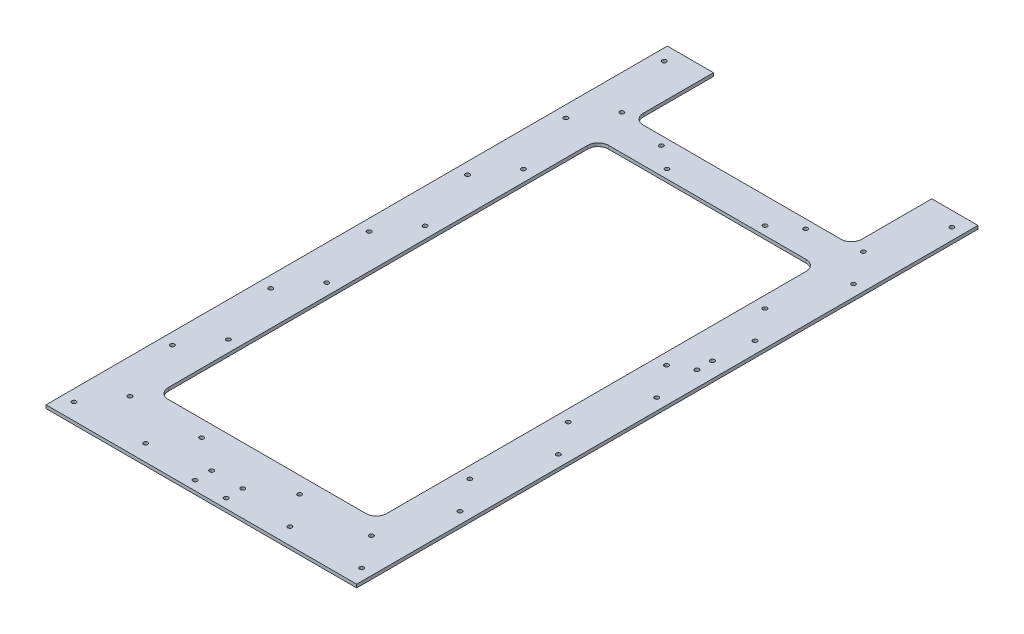
from build123d import *

# Parameters (mm, degrees)
SKETCH1_W           = 300
SKETCH1_H           = 600
BOSS_EXTRUDE1_DEPTH = 3.175
CUT_EXTRUDE1_DEPTH  = 10
SKETCH4_R           = 2.05
CUT_EXTRUDE2_DEPTH  = 51
SKETCH5_R           = 2.1
CUT_EXTRUDE3_DEPTH  = 67
SKETCH7_R           = 2.05
CUT_EXTRUDE4_DEPTH  = 10


with BuildPart() as part:
    # Sketch1 → Boss-Extrude1 (new body)
    with BuildSketch(Plane(origin=(0, 0, 0), x_dir=(1, 0, 0), z_dir=(0, 1, 0))):
        Rectangle(SKETCH1_W, SKETCH1_H)
    extrude(amount=BOSS_EXTRUDE1_DEPTH)

    # Sketch3 → Cut-Extrude1 (cut)
    with BuildSketch(Plane(origin=(0, 3.175, 0), x_dir=(1, 0, 0), z_dir=(0, 1, 0))):
        with BuildLine():
            Line((-95.445664395, -236.484492038), (95.445664395, -236.484492038))
            ThreePointArc((95.445664395, -236.484492038), (102.516732207, -233.55555985), (105.445664395, -226.484492038))
            Line((105.445664395, -226.484492038), (105.445664395, 178.578479092))
            ThreePointArc((105.445664395, 178.578479092), (102.516732207, 185.649546903), (95.445664395, 188.578479092))
            Line((95.445664395, 188.578479092), (-95.445664395, 188.578479092))
            ThreePointArc((-95.445664395, 188.578479092), (-102.516732207, 185.649546903), (-105.445664395, 178.578479092))
            Line((-105.445664395, 178.578479092), (-105.445664395, -226.484492038))
            ThreePointArc((-105.445664395, -226.484492038), (-102.516732207, -233.55555985), (-95.445664395, -236.484492038))
        make_face()
        with BuildLine():
            Line((105.445664395, 338.770518263), (105.445664395, 232.318098583))
            ThreePointArc((105.445664395, 232.318098583), (102.516732207, 225.247030771), (95.445664395, 222.318098583))
            Line((95.445664395, 222.318098583), (-95.445664395, 222.318098583))
            ThreePointArc((-95.445664395, 222.318098583), (-102.516732207, 225.247030771), (-105.445664395, 232.318098583))
            Line((-105.445664395, 232.318098583), (-105.445664395, 338.770518263))
            ThreePointArc((-105.445664395, 338.770518263), (-102.516732207, 345.841586075), (-95.445664395, 348.770518263))
            Line((-95.445664395, 348.770518263), (95.445664395, 348.770518263))
            ThreePointArc((95.445664395, 348.770518263), (102.516732207, 345.841586075), (105.445664395, 338.770518263))
        make_face()
    extrude(amount=-CUT_EXTRUDE1_DEPTH, mode=Mode.SUBTRACT)

    # Sketch4 → Cut-Extrude2 (cut)
    with BuildSketch(Plane(origin=(0, 3.175, 0), x_dir=(1, 0, 0), z_dir=(0, 1, 0))):
        with Locations((15, -291)):
            Circle(SKETCH4_R)
        with Locations((-15, -291)):
            Circle(SKETCH4_R)
        with Locations((-15, -275)):
            Circle(SKETCH4_R)
        with Locations((15, -275)):
            Circle(SKETCH4_R)
    extrude(amount=-CUT_EXTRUDE2_DEPTH, mode=Mode.SUBTRACT)

    # Sketch5 → Cut-Extrude3 (cut)
    with BuildSketch(Plane(origin=(0, 3.175, 0), x_dir=(1, 0, 0), z_dir=(0, 1, 0))):
        with Locations((135, 43.495009338)):
            Circle(SKETCH5_R)
        with Locations((135, 58.495009338)):
            Circle(SKETCH5_R)
    extrude(amount=-CUT_EXTRUDE3_DEPTH, mode=Mode.SUBTRACT)

    # Sketch7 → Cut-Extrude4 (cut)
    with BuildSketch(Plane(origin=(0, 3.175, 0), x_dir=(1, 0, 0), z_dir=(0, 1, 0))):
        with Locations((138.861416099, -284.12112301)):
            Circle(SKETCH7_R)
        with Locations((116.584248296, -252.363369029)):
            Circle(SKETCH7_R)
        with Locations((47.357849803, -252.363369029)):
            Circle(SKETCH7_R)
        with Locations((69.635017605, -284.12112301)):
            Circle(SKETCH7_R)
        with Locations((116.584248296, -157.363369029)):
            Circle(SKETCH7_R)
        with Locations((138.861416099, -189.12112301)):
            Circle(SKETCH7_R)
        with Locations((116.584248296, -62.363369029)):
            Circle(SKETCH7_R)
        with Locations((138.861416099, -94.12112301)):
            Circle(SKETCH7_R)
        with Locations((116.584248296, 32.636630971)):
            Circle(SKETCH7_R)
        with Locations((138.861416099, 0.87887699)):
            Circle(SKETCH7_R)
        with Locations((116.584248296, 127.636630971)):
            Circle(SKETCH7_R)
        with Locations((138.861416099, 95.87887699)):
            Circle(SKETCH7_R)
        with Locations((116.584248296, 222.636630971)):
            Circle(SKETCH7_R)
        with Locations((138.861416099, 190.87887699)):
            Circle(SKETCH7_R)
        with Locations((116.584248296, 317.636630971)):
            Circle(SKETCH7_R)
        with Locations((138.861416099, 285.87887699)):
            Circle(SKETCH7_R)
        with Locations((47.357849803, 197.013383964)):
            Circle(SKETCH7_R)
        with Locations((69.635017605, 213.88319371)):
            Circle(SKETCH7_R)
        with Locations((-47.357849803, 197.013383964)):
            Circle(SKETCH7_R)
        with Locations((-69.635017605, 213.88319371)):
            Circle(SKETCH7_R)
        with Locations((-138.861416099, 285.87887699)):
            Circle(SKETCH7_R)
        with Locations((-116.584248296, 222.636630971)):
            Circle(SKETCH7_R)
        with Locations((-138.861416099, 190.87887699)):
            Circle(SKETCH7_R)
        with Locations((-138.861416099, 95.87887699)):
            Circle(SKETCH7_R)
        with Locations((-116.584248296, 32.636630971)):
            Circle(SKETCH7_R)
        with Locations((-116.584248296, 127.636630971)):
            Circle(SKETCH7_R)
        with Locations((-116.584248296, -62.363369029)):
            Circle(SKETCH7_R)
        with Locations((-138.861416099, 0.87887699)):
            Circle(SKETCH7_R)
        with Locations((-138.861416099, -94.12112301)):
            Circle(SKETCH7_R)
        with Locations((-116.584248296, -157.363369029)):
            Circle(SKETCH7_R)
        with Locations((-138.861416099, -189.12112301)):
            Circle(SKETCH7_R)
        with Locations((-116.584248296, -252.363369029)):
            Circle(SKETCH7_R)
        with Locations((-138.861416099, -284.12112301)):
            Circle(SKETCH7_R)
        with Locations((-47.357849803, -252.363369029)):
            Circle(SKETCH7_R)
        with Locations((-69.635017605, -284.12112301)):
            Circle(SKETCH7_R)
    extrude(amount=-CUT_EXTRUDE4_DEPTH, mode=Mode.SUBTRACT)


solid = part.part
